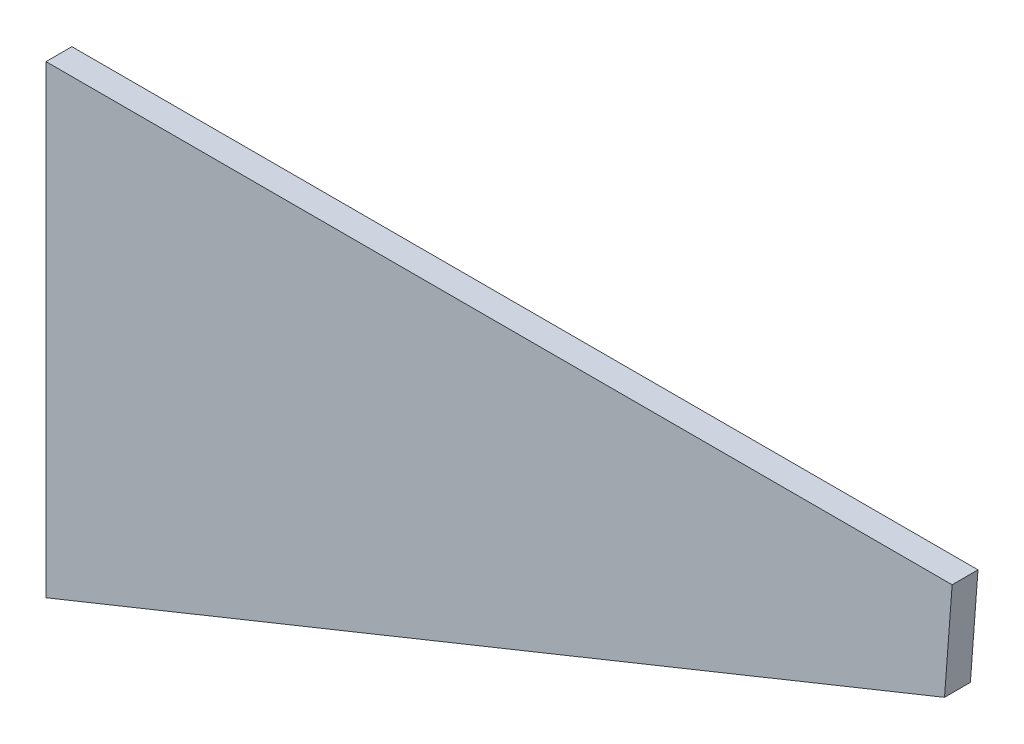
from build123d import *

# Parameters (mm, degrees)
BOSS_EXTRUDE1_DEPTH = 19.05


with BuildPart() as part:
    # Sketch1 → Boss-Extrude1 (new body)
    with BuildSketch(Plane.XY):
        Polygon((2683.51, 6983.72999014), (2683.51, 6641.741886848), (3345.280922092, 6909.114694868), (3350.880001041, 6983.72999014), align=None)
    extrude(amount=BOSS_EXTRUDE1_DEPTH)


solid = part.part
